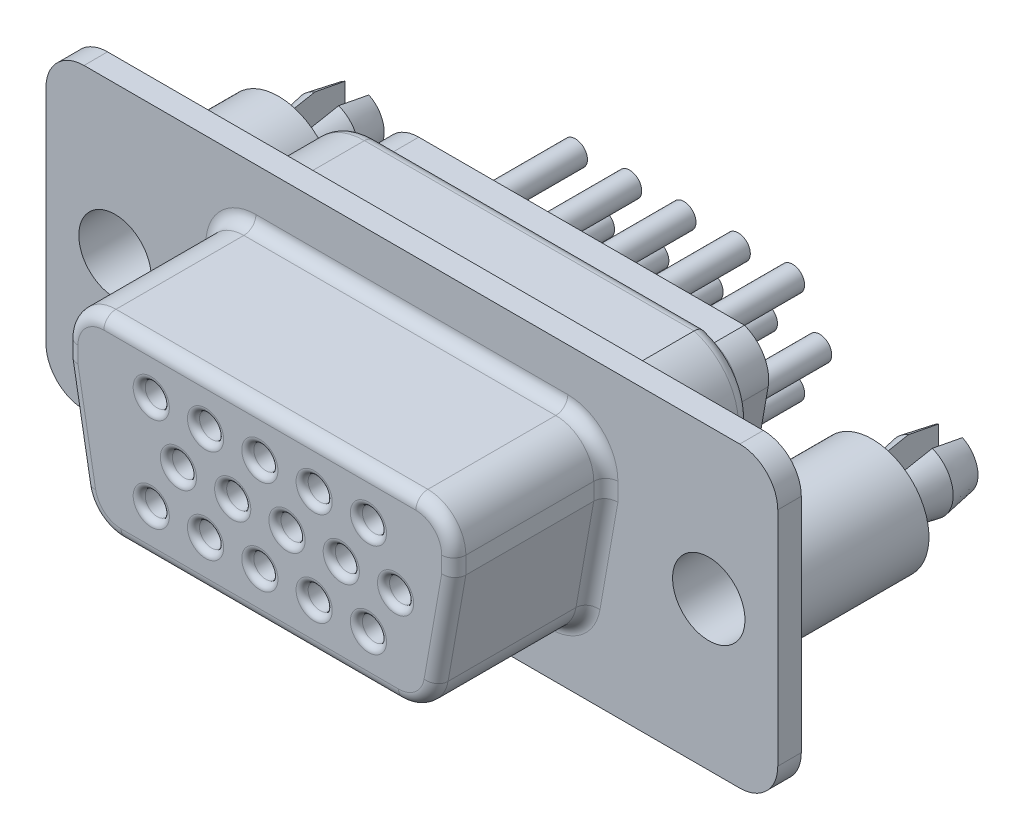
from build123d import *

# Parameters (mm, degrees)
BASE_EXTRUDE_DEPTH             = 0.9906
SKETCH8_R                      = 1.524
CUT_EXTRUDE4_DEPTH             = 17.663101776
BOSS_EXTRUDE4_DEPTH            = 6.4008
FILLET1_R                      = 0.508
FILLET2_R                      = 0.508
SKETCH13_R                     = 0.508
CUT_EXTRUDE6_DEPTH             = 6.4008
BOSS_EXTRUDE5_DEPTH            = 4.1148
BOSS_EXTRUDE6_DEPTH            = 1.778
SKETCH16_R                     = 0.508
BOSS_EXTRUDE7_DEPTH            = 4.572
SKETCH17_R                     = 2.3876
BOSS_EXTRUDE8_DEPTH            = 5.8928
SKETCH18_R                     = 1.016
BOSS_EXTRUDE9_DEPTH            = 2.032
BOSS_EXTRUDE9_DRAFT            = -10
BOSS_EXTRUDE9_PROFILE_2_DEPTH  = 2.032
BOSS_EXTRUDE9_PROFILE_2_DRAFT  = -10
SKETCH19_R                     = 1.374296425
BOSS_EXTRUDE10_DEPTH           = 1.27
BOSS_EXTRUDE10_DRAFT           = 10
BOSS_EXTRUDE10_PROFILE_2_DEPTH = 1.27
BOSS_EXTRUDE10_PROFILE_2_DRAFT = 10
CUT_EXTRUDE7_START             = -3.302
CUT_EXTRUDE7_DEPTH             = 3.302
FILLET3_R                      = 0.508
SKETCH21_R                     = 1.524
CUT_EXTRUDE8_DEPTH             = 3.175
FILLET4_R                      = 0.254


with BuildPart() as part:
    # Sketch1 → Base-Extrude (new body)
    with BuildSketch(Plane.XY):
        with BuildLine():
            Line((-13.8049, 6.2738), (13.8049, 6.2738))
            ThreePointArc((13.8049, 6.2738), (14.936412271, 5.805112271), (15.4051, 4.6736))
            Line((15.4051, 4.6736), (15.4051, -4.6736))
            ThreePointArc((15.4051, -4.6736), (14.936412271, -5.805112271), (13.8049, -6.2738))
            Line((13.8049, -6.2738), (-13.8049, -6.2738))
            ThreePointArc((-13.8049, -6.2738), (-14.936412271, -5.805112271), (-15.4051, -4.6736))
            Line((-15.4051, -4.6736), (-15.4051, 4.6736))
            ThreePointArc((-15.4051, 4.6736), (-14.936412271, 5.805112271), (-13.8049, 6.2738))
        make_face()
    extrude(amount=-BASE_EXTRUDE_DEPTH)

    # Sketch8 → Cut-Extrude4 (cut, through all)
    with BuildSketch(Plane.XY):
        with Locations((12.5, -0.0262)):
            Circle(SKETCH8_R)
        with Locations(Location((-12.5, -0.0262, 0), (0, 0, 180))):
            Circle(SKETCH8_R)
    extrude(amount=-CUT_EXTRUDE4_DEPTH, mode=Mode.SUBTRACT)

    # Sketch9 → Boss-Extrude4 (add)
    with BuildSketch(Plane.XY):
        with BuildLine():
            Line((-6.5659, 3.9497), (6.5659, 3.9497))
            ThreePointArc((6.5659, 3.9497), (7.697412271, 3.481012271), (8.1661, 2.3495))
            Line((8.1661, 2.3495), (8.1661, 1.6256))
            Line((8.1661, 1.6256), (7.416186321, -2.627371814))
            ThreePointArc((7.416186321, -2.627371814), (6.868885688, -3.575324318), (5.840296955, -3.9497))
            Line((5.840296955, -3.9497), (-5.840296955, -3.9497))
            ThreePointArc((-5.840296955, -3.9497), (-6.868885688, -3.575324318), (-7.416186321, -2.627371814))
            Line((-7.416186321, -2.627371814), (-8.1661, 1.6256))
            Line((-8.1661, 1.6256), (-8.1661, 2.3495))
            ThreePointArc((-8.1661, 2.3495), (-7.697412271, 3.481012271), (-6.5659, 3.9497))
        make_face()
    extrude(amount=BOSS_EXTRUDE4_DEPTH)

    # Fillet1
    fillet1_edges = [part.edges().sort_by_distance(p)[0] for p in [
        (6.868885688, -3.575324318, 0),
        (-7.697412271, 3.481012271, 0),
        (-8.1661, 1.98755, 0),
        (-7.791143161, -0.500885907, 0),
        (-6.868885688, -3.575324318, 0),
        (0, -3.9497, 0),
        (0, 3.9497, 0),
        (7.697412271, 3.481012271, 0),
        (8.1661, 1.98755, 0),
        (7.791143161, -0.500885907, 0),
    ]]
    fillet(fillet1_edges, radius=FILLET1_R)

    # Fillet2
    fillet2_edges = [part.edges().sort_by_distance(p)[0] for p in [
        (7.791143161, -0.500885907, 6.4008),
        (8.1661, 1.98755, 6.4008),
        (7.697412271, 3.481012271, 6.4008),
        (0, 3.9497, 6.4008),
        (0, -3.9497, 6.4008),
        (6.868885688, -3.575324318, 6.4008),
        (-7.697412271, 3.481012271, 6.4008),
        (-8.1661, 1.98755, 6.4008),
        (-7.791143161, -0.500885907, 6.4008),
        (-6.868885688, -3.575324318, 6.4008),
    ]]
    fillet(fillet2_edges, radius=FILLET2_R)

    # Sketch13 → Cut-Extrude6 (cut)
    with BuildSketch(Plane.XY.offset(6.4008)):
        with Locations((0, 1.9812)):
            Circle(SKETCH13_R)
        with Locations((0, -1.9812)):
            Circle(SKETCH13_R)
        with Locations((2.286, 1.9812)):
            Circle(SKETCH13_R)
        with Locations(Location((-2.286, 1.9812, 0), (0, 0, 180))):
            Circle(SKETCH13_R)
        with Locations((4.572, 1.9812)):
            Circle(SKETCH13_R)
        with Locations(Location((-4.572, 1.9812, 0), (0, 0, 180))):
            Circle(SKETCH13_R)
        with Locations(Location((-1.143, 0, 0), (0, 0, 180))):
            Circle(SKETCH13_R)
        with Locations((3.429, 0)):
            Circle(SKETCH13_R)
        with Locations(Location((1.143, 0, 0), (0, 0, 180))):
            Circle(SKETCH13_R)
        with Locations((-3.429, 0)):
            Circle(SKETCH13_R)
        with Locations((5.715, 0)):
            Circle(SKETCH13_R)
        with Locations((2.286, -1.9812)):
            Circle(SKETCH13_R)
        with Locations(Location((-2.286, -1.9812, 0), (0, 0, 180))):
            Circle(SKETCH13_R)
        with Locations((4.572, -1.9812)):
            Circle(SKETCH13_R)
        with Locations(Location((-4.572, -1.9812, 0), (0, 0, 180))):
            Circle(SKETCH13_R)
    extrude(amount=-CUT_EXTRUDE6_DEPTH, mode=Mode.SUBTRACT)

    # Sketch14 → Boss-Extrude5 (add)
    with BuildSketch(Plane(origin=(0, 0, -0.9906), x_dir=(-1, 0, 0), z_dir=(0, 0, -1))):
        with BuildLine():
            Line((6.594340868, 4.8387), (-7.283574657, 4.8387))
            ThreePointArc((-7.283574657, 4.8387), (-8.763842485, 3.720712014), (-9.117136349, 1.899648197))
            Line((-9.117136349, 1.899648197), (-8.291680413, -2.781745044))
            ThreePointArc((-8.291680413, -2.781745044), (-7.440323873, -4.256337828), (-5.840296955, -4.8387))
            Line((-5.840296955, -4.8387), (5.840296955, -4.8387))
            ThreePointArc((5.840296955, -4.8387), (7.440323873, -4.256337828), (8.291680413, -2.781745044))
            Line((8.291680413, -2.781745044), (9.107301229, 1.843870462))
            ThreePointArc((9.107301229, 1.843870462), (8.549077023, 3.927191561), (6.594340868, 4.8387))
        make_face()
    extrude(amount=BOSS_EXTRUDE5_DEPTH)

    # Sketch15 → Boss-Extrude6 (add)
    with BuildSketch(Plane(origin=(0, 0, -5.1054), x_dir=(-1, 0, 0), z_dir=(0, 0, -1))):
        with BuildLine():
            Line((-8.116571672, 2.076074746), (-7.291115736, -2.605318495))
            ThreePointArc((-7.291115736, -2.605318495), (-6.787251661, -3.478036674), (-5.840296955, -3.8227))
            Line((-5.840296955, -3.8227), (5.840296955, -3.8227))
            ThreePointArc((5.840296955, -3.8227), (6.787251661, -3.478036674), (7.291115736, -2.605318495))
            Line((7.291115736, -2.605318495), (8.106736552, 2.02029701))
            ThreePointArc((8.106736552, 2.02029701), (7.770775869, 3.27411935), (6.594340868, 3.8227))
            Line((6.594340868, 3.8227), (-7.121800858, 3.8227))
            ThreePointArc((-7.121800858, 3.8227), (-7.934142267, 3.12876703), (-8.116571672, 2.076074746))
        make_face()
    extrude(amount=BOSS_EXTRUDE6_DEPTH)

    # Sketch16 → Boss-Extrude7 (add)
    with BuildSketch(Plane(origin=(0, 0, -6.8834), x_dir=(-1, 0, 0), z_dir=(0, 0, -1))):
        with Locations(Location((-4.572, -1.9812, 0), (0, 0, 180))):
            Circle(SKETCH16_R)
        with Locations(Location((-2.286, -1.9812, 0), (0, 0, 180))):
            Circle(SKETCH16_R)
        with Locations(Location((0, -1.9812, 0), (0, 0, 180))):
            Circle(SKETCH16_R)
        with Locations((2.286, -1.9812)):
            Circle(SKETCH16_R)
        with Locations((4.572, -1.9812)):
            Circle(SKETCH16_R)
        with Locations(Location((3.429, 0, 0), (0, 0, 180))):
            Circle(SKETCH16_R)
        with Locations((1.143, 0)):
            Circle(SKETCH16_R)
        with Locations((-1.143, 0)):
            Circle(SKETCH16_R)
        with Locations(Location((-3.429, 0, 0), (0, 0, 180))):
            Circle(SKETCH16_R)
        with Locations(Location((-5.715, 0, 0), (0, 0, 180))):
            Circle(SKETCH16_R)
        with Locations(Location((-4.572, 1.9812, 0), (0, 0, 180))):
            Circle(SKETCH16_R)
        with Locations(Location((-2.286, 1.9812, 0), (0, 0, 180))):
            Circle(SKETCH16_R)
        with Locations(Location((0, 1.9812, 0), (0, 0, 180))):
            Circle(SKETCH16_R)
        with Locations((2.286, 1.9812)):
            Circle(SKETCH16_R)
        with Locations((4.572, 1.9812)):
            Circle(SKETCH16_R)
    extrude(amount=BOSS_EXTRUDE7_DEPTH)

    # Sketch17 → Boss-Extrude8 (add)
    with BuildSketch(Plane(origin=(0, 0, -0.9906), x_dir=(-1, 0, 0), z_dir=(0, 0, -1))):
        with Locations((12.5, -0.0262)):
            Circle(SKETCH17_R)
        with Locations((-12.5, -0.0262)):
            Circle(SKETCH17_R)
    extrude(amount=BOSS_EXTRUDE8_DEPTH)


with BuildPart() as boss_extrude9_tool:
    # Sketch18 → Boss-Extrude9 (with draft: the straight prism first)
    with BuildSketch(Plane(origin=(0, 0, -6.8834), x_dir=(-1, 0, 0), z_dir=(0, 0, -1))):
        with Locations((12.5, -0.0262)):
            Circle(SKETCH18_R)
    extrude(amount=BOSS_EXTRUDE9_DEPTH)
    # Boss-Extrude9: the draft: its side faces are tilted about the plane it starts from
    boss_extrude9_sides = [boss_extrude9_tool.faces().sort_by_distance(p)[0] for p in [
        (-11.484, -0.0262, -7.8994),
    ]]
    draft(boss_extrude9_sides, Plane(origin=(0, 0, -6.8834), x_dir=(-1, 0, 0), z_dir=(0, 0, -1)), BOSS_EXTRUDE9_DRAFT)


with BuildPart() as part_1:
    add(part.part)

    # Boss-Extrude9: add boss_extrude9_tool
    add(boss_extrude9_tool.part)


with BuildPart() as boss_extrude9_profile_2_tool:
    # Sketch18 → Boss-Extrude9 profile 2 (with draft: the straight prism first)
    with BuildSketch(Plane(origin=(0, 0, -6.8834), x_dir=(-1, 0, 0), z_dir=(0, 0, -1))):
        with Locations((-12.5, -0.0262)):
            Circle(SKETCH18_R)
    extrude(amount=BOSS_EXTRUDE9_PROFILE_2_DEPTH)
    # Boss-Extrude9 profile 2: the draft: its side faces are tilted about the plane it starts from
    boss_extrude9_profile_2_sides = [boss_extrude9_profile_2_tool.faces().sort_by_distance(p)[0] for p in [
        (13.516, -0.0262, -7.8994),
    ]]
    draft(boss_extrude9_profile_2_sides, Plane(origin=(0, 0, -6.8834), x_dir=(-1, 0, 0), z_dir=(0, 0, -1)), BOSS_EXTRUDE9_PROFILE_2_DRAFT)


with BuildPart() as part_2:
    add(part_1.part)

    # Boss-Extrude9 profile 2: add boss_extrude9_profile_2_tool
    add(boss_extrude9_profile_2_tool.part)


with BuildPart() as boss_extrude10_tool:
    # Sketch19 → Boss-Extrude10 (with draft: the straight prism first)
    with BuildSketch(Plane(origin=(0, 0, -8.9154), x_dir=(-1, 0, 0), z_dir=(0, 0, -1))):
        with Locations((-12.5, -0.0262)):
            Circle(SKETCH19_R)
    extrude(amount=BOSS_EXTRUDE10_DEPTH)
    # Boss-Extrude10: the draft: its side faces are tilted about the plane it starts from
    boss_extrude10_sides = [boss_extrude10_tool.faces().sort_by_distance(p)[0] for p in [
        (13.874296425, -0.0262, -9.5504),
    ]]
    draft(boss_extrude10_sides, Plane(origin=(0, 0, -8.9154), x_dir=(-1, 0, 0), z_dir=(0, 0, -1)), BOSS_EXTRUDE10_DRAFT)


with BuildPart() as part_3:
    add(part_2.part)

    # Boss-Extrude10: add boss_extrude10_tool
    add(boss_extrude10_tool.part)


with BuildPart() as boss_extrude10_profile_2_tool:
    # Sketch19 → Boss-Extrude10 profile 2 (with draft: the straight prism first)
    with BuildSketch(Plane(origin=(0, 0, -8.9154), x_dir=(-1, 0, 0), z_dir=(0, 0, -1))):
        with Locations((12.5, -0.0262)):
            Circle(SKETCH19_R)
    extrude(amount=BOSS_EXTRUDE10_PROFILE_2_DEPTH)
    # Boss-Extrude10 profile 2: the draft: its side faces are tilted about the plane it starts from
    boss_extrude10_profile_2_sides = [boss_extrude10_profile_2_tool.faces().sort_by_distance(p)[0] for p in [
        (-11.125703575, -0.0262, -9.5504),
    ]]
    draft(boss_extrude10_profile_2_sides, Plane(origin=(0, 0, -8.9154), x_dir=(-1, 0, 0), z_dir=(0, 0, -1)), BOSS_EXTRUDE10_PROFILE_2_DRAFT)


with BuildPart() as part_4:
    add(part_3.part)

    # Boss-Extrude10 profile 2: add boss_extrude10_profile_2_tool
    add(boss_extrude10_profile_2_tool.part)

    # Sketch20 → Cut-Extrude7 (cut)
    with BuildSketch(Plane(origin=(0, 0, -10.1854), x_dir=(-1, 0, 0), z_dir=(0, 0, -1)).offset(CUT_EXTRUDE7_START)):
        with BuildLine():
            Line((-11.992, 1.25075993), (-11.992, -1.30315993))
            ThreePointArc((-11.992, -1.30315993), (-12.493776079, -1.400482331), (-12.996413074, -1.307708768))
            Line((-12.996413074, -1.307708768), (-12.996413074, 1.255308768))
            ThreePointArc((-12.996413074, 1.255308768), (-12.493776079, 1.348082331), (-11.992, 1.25075993))
        make_face()
        with BuildLine():
            Line((11.99812802, 1.253180779), (11.99812802, -1.305580779))
            ThreePointArc((11.99812802, -1.305580779), (12.497070495, -1.400493302), (12.996413074, -1.307708768))
            Line((12.996413074, -1.307708768), (12.996413074, 1.255308768))
            ThreePointArc((12.996413074, 1.255308768), (12.497070495, 1.348093302), (11.99812802, 1.253180779))
        make_face()
    extrude(amount=CUT_EXTRUDE7_DEPTH, mode=Mode.SUBTRACT)

    # Fillet3
    fillet3_edges = [part_4.edges().sort_by_distance(p)[0] for p in [
        (7.934142267, 3.12876703, -5.1054),
        (7.703843704, -0.264621875, -5.1054),
        (6.787251661, -3.478036674, -5.1054),
        (0, -3.8227, -5.1054),
        (-6.787251661, -3.478036674, -5.1054),
        (-7.698926144, -0.292510743, -5.1054),
        (-7.770775869, 3.27411935, -5.1054),
        (0.263729995, 3.8227, -5.1054),
    ]]
    fillet(fillet3_edges, radius=FILLET3_R)
    # the kernel refuses this fillet: 0.508 mm, written as the material it takes off along each edge
    with BuildSketch(Plane(origin=(6.5659, 2.3495, -5.1054), x_dir=(-0.2081700063760291, 0.9780926584150419, 0), z_dir=(-0.9780926584150419, -0.2081700063760291, 0))) as fillet3_2_piece_1:
        with BuildLine():
            CenterArc((2.590593282 - FILLET3_R, -FILLET3_R), FILLET3_R, 0, 90)
            Line((2.590593282, -FILLET3_R), (2.590593282 + FILLET3_R * 0.02, -FILLET3_R))
            Line((2.590593282 + FILLET3_R * 0.02, -FILLET3_R), (2.590593282 + FILLET3_R * 0.02, FILLET3_R * 0.02))
            Line((2.590593282 + FILLET3_R * 0.02, FILLET3_R * 0.02), (2.590593282 - FILLET3_R, FILLET3_R * 0.02))
            Line((2.590593282 - FILLET3_R, FILLET3_R * 0.02), (2.590593282 - FILLET3_R, 0))
        make_face()
    revolve(axis=Axis((6.5659, 2.3495, -5.1054), (0, 0, -1)), revolution_arc=112.015131466, mode=Mode.SUBTRACT)
    with BuildSketch(Plane(origin=(5.840296955, -2.3495, -5.1054), x_dir=(0.9848077530122078, -0.1736481776669324, 0), z_dir=(0.1736481776669324, 0.9848077530122078, 0))) as fillet3_2_piece_2:
        with BuildLine():
            CenterArc((2.4892 - FILLET3_R, -FILLET3_R), FILLET3_R, 0, 90)
            Line((2.4892, -FILLET3_R), (2.4892 + FILLET3_R * 0.02, -FILLET3_R))
            Line((2.4892 + FILLET3_R * 0.02, -FILLET3_R), (2.4892 + FILLET3_R * 0.02, FILLET3_R * 0.02))
            Line((2.4892 + FILLET3_R * 0.02, FILLET3_R * 0.02), (2.4892 - FILLET3_R, FILLET3_R * 0.02))
            Line((2.4892 - FILLET3_R, FILLET3_R * 0.02), (2.4892 - FILLET3_R, 0))
        make_face()
    revolve(axis=Axis((5.840296955, -2.3495, -5.1054), (0, 0, -1)), revolution_arc=80, mode=Mode.SUBTRACT)
    with BuildSketch(Plane(origin=(-5.840296955, -2.3495, -5.1054), x_dir=(0, -1, 0), z_dir=(1, 0, 0))) as fillet3_2_piece_3:
        with BuildLine():
            CenterArc((2.4892 - FILLET3_R, -FILLET3_R), FILLET3_R, 0, 90)
            Line((2.4892, -FILLET3_R), (2.4892 + FILLET3_R * 0.02, -FILLET3_R))
            Line((2.4892 + FILLET3_R * 0.02, -FILLET3_R), (2.4892 + FILLET3_R * 0.02, FILLET3_R * 0.02))
            Line((2.4892 + FILLET3_R * 0.02, FILLET3_R * 0.02), (2.4892 - FILLET3_R, FILLET3_R * 0.02))
            Line((2.4892 - FILLET3_R, FILLET3_R * 0.02), (2.4892 - FILLET3_R, 0))
        make_face()
    revolve(axis=Axis((-5.840296955, -2.3495, -5.1054), (0, 0, -1)), revolution_arc=80, mode=Mode.SUBTRACT)
    with BuildSketch(Plane(origin=(-6.594340868, 2.286973175, -5.1054), x_dir=(-0.9848077530122075, -0.17364817766693372, 0), z_dir=(0.17364817766693372, -0.9848077530122075, 0))) as fillet3_2_piece_4:
        with BuildLine():
            CenterArc((2.551726825 - FILLET3_R, -FILLET3_R), FILLET3_R, 0, 90)
            Line((2.551726825, -FILLET3_R), (2.551726825 + FILLET3_R * 0.02, -FILLET3_R))
            Line((2.551726825 + FILLET3_R * 0.02, -FILLET3_R), (2.551726825 + FILLET3_R * 0.02, FILLET3_R * 0.02))
            Line((2.551726825 + FILLET3_R * 0.02, FILLET3_R * 0.02), (2.551726825 - FILLET3_R, FILLET3_R * 0.02))
            Line((2.551726825 - FILLET3_R, FILLET3_R * 0.02), (2.551726825 - FILLET3_R, 0))
        make_face()
    revolve(axis=Axis((-6.594340868, 2.286973175, -5.1054), (0, 0, -1)), revolution_arc=100, mode=Mode.SUBTRACT)
    with BuildSketch(Plane(origin=(9.117136349, 1.899648197, -5.1054), x_dir=(-0.9848077530122079, 0.17364817766693127, 0), z_dir=(-0.17364817766693125, -0.9848077530122079, 0))) as fillet3_2_piece_5:
        with BuildLine():
            CenterArc((FILLET3_R, -FILLET3_R), FILLET3_R, 90, 90)
            Line((0, -FILLET3_R), (-FILLET3_R * 0.02, -FILLET3_R))
            Line((-FILLET3_R * 0.02, -FILLET3_R), (-FILLET3_R * 0.02, FILLET3_R * 0.02))
            Line((-FILLET3_R * 0.02, FILLET3_R * 0.02), (FILLET3_R, FILLET3_R * 0.02))
            Line((FILLET3_R, FILLET3_R * 0.02), (FILLET3_R, 0))
        make_face()
    extrude(amount=4.753611278, mode=Mode.SUBTRACT)
    with BuildSketch(Plane(origin=(5.840296955, -4.8387, -5.1054), x_dir=(0, 1, 0), z_dir=(-1, 0, 0))) as fillet3_2_piece_6:
        with BuildLine():
            CenterArc((FILLET3_R, -FILLET3_R), FILLET3_R, 90, 90)
            Line((0, -FILLET3_R), (-FILLET3_R * 0.02, -FILLET3_R))
            Line((-FILLET3_R * 0.02, -FILLET3_R), (-FILLET3_R * 0.02, FILLET3_R * 0.02))
            Line((-FILLET3_R * 0.02, FILLET3_R * 0.02), (FILLET3_R, FILLET3_R * 0.02))
            Line((FILLET3_R, FILLET3_R * 0.02), (FILLET3_R, 0))
        make_face()
    extrude(amount=11.680593909, mode=Mode.SUBTRACT)
    with BuildSketch(Plane(origin=(-8.291680413, -2.781745044, -5.1054), x_dir=(0.9848077530122078, 0.17364817766693208, 0), z_dir=(-0.17364817766693205, 0.9848077530122078, 0))) as fillet3_2_piece_7:
        with BuildLine():
            CenterArc((FILLET3_R, -FILLET3_R), FILLET3_R, 90, 90)
            Line((0, -FILLET3_R), (-FILLET3_R * 0.02, -FILLET3_R))
            Line((-FILLET3_R * 0.02, -FILLET3_R), (-FILLET3_R * 0.02, FILLET3_R * 0.02))
            Line((-FILLET3_R * 0.02, FILLET3_R * 0.02), (FILLET3_R, FILLET3_R * 0.02))
            Line((FILLET3_R, FILLET3_R * 0.02), (FILLET3_R, 0))
        make_face()
    extrude(amount=4.696973081, mode=Mode.SUBTRACT)
    with BuildSketch(Plane(origin=(-6.594340868, 4.8387, -5.1054), x_dir=(0, -1, 0), z_dir=(1, 0, 0))) as fillet3_2_piece_8:
        with BuildLine():
            CenterArc((FILLET3_R, -FILLET3_R), FILLET3_R, 90, 90)
            Line((0, -FILLET3_R), (-FILLET3_R * 0.02, -FILLET3_R))
            Line((-FILLET3_R * 0.02, -FILLET3_R), (-FILLET3_R * 0.02, FILLET3_R * 0.02))
            Line((-FILLET3_R * 0.02, FILLET3_R * 0.02), (FILLET3_R, FILLET3_R * 0.02))
            Line((FILLET3_R, FILLET3_R * 0.02), (FILLET3_R, 0))
        make_face()
    extrude(amount=15.147915526, mode=Mode.SUBTRACT)

    # Sketch21 → Cut-Extrude8 (cut)
    with BuildSketch(Plane.XY.offset(-0.9906)):
        with Locations((-12.5, -0.0262)):
            Circle(SKETCH21_R)
        with Locations((12.5, -0.0262)):
            Circle(SKETCH21_R)
    extrude(amount=-CUT_EXTRUDE8_DEPTH, mode=Mode.SUBTRACT)

    # Fillet4
    fillet4_edges = [part_4.edges().sort_by_distance(p)[0] for p in [
        (5.207, 0, 6.4008),
        (-0.508, 1.9812, 6.4008),
        (-0.508, -1.9812, 6.4008),
        (1.778, 1.9812, 6.4008),
        (-1.778, 1.9812, 6.4008),
        (4.064, 1.9812, 6.4008),
        (-4.064, 1.9812, 6.4008),
        (-0.635, 0, 6.4008),
        (2.921, 0, 6.4008),
        (1.651, 0, 6.4008),
        (-3.937, 0, 6.4008),
        (1.778, -1.9812, 6.4008),
        (-1.778, -1.9812, 6.4008),
        (4.064, -1.9812, 6.4008),
        (-4.064, -1.9812, 6.4008),
    ]]
    fillet(fillet4_edges, radius=FILLET4_R)


solid = part_4.part
